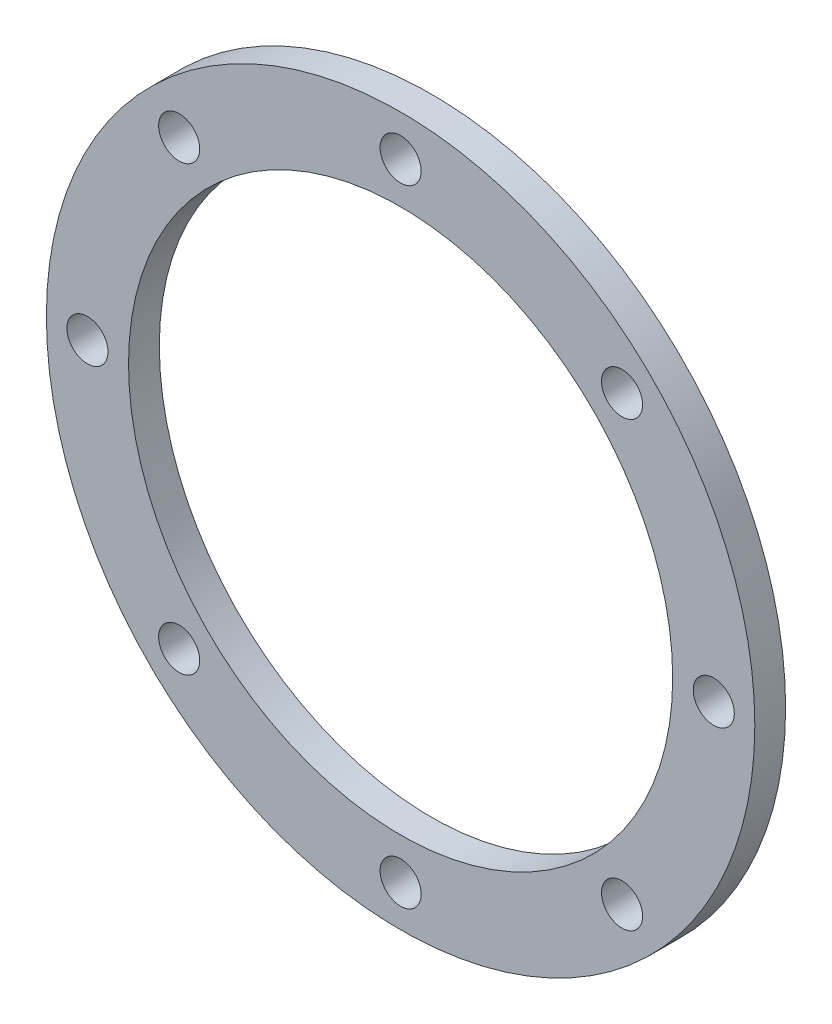
from build123d import *

# Parameters (mm, degrees)
SKETCH1_R         = 109.5375
SKETCH1_R_2       = 84.1375
EXTRUDE1_DEPTH    = 9.525
CIRPATTERN2_COUNT = 8


with BuildPart() as part:
    # Sketch1 → Extrude1 (new body)
    with BuildSketch(Plane.XY):
        Circle(SKETCH1_R)
        Circle(SKETCH1_R_2, mode=Mode.SUBTRACT)
    extrude(amount=EXTRUDE1_DEPTH)

    # Sketch2 → 1/2 (0.5) Diameter Hole3 (revolve, cut)
    with BuildSketch(Plane(origin=(0, 96.8375, 9.525), x_dir=(0, -1, 0), z_dir=(1, 0, 0))):
        Polygon((0, 0), (0, 29.215464931), (6.35, 25.4), (6.35, 0), align=None)
    f_1_2_0_5_diameter_hole3 = revolve(axis=Axis((0, 96.8375, 15.875), (0, 0, -1)), mode=Mode.SUBTRACT)

    # CirPattern2: 1/2 (0.5) Diameter Hole3 ×8 about axis
    cirpattern2_axis = Axis((0, 0, 9.525), (0, 0, -1))
    for i in range(1, CIRPATTERN2_COUNT):
        add(f_1_2_0_5_diameter_hole3.rotate(cirpattern2_axis, i * 360 / CIRPATTERN2_COUNT), mode=Mode.SUBTRACT)


solid = part.part
